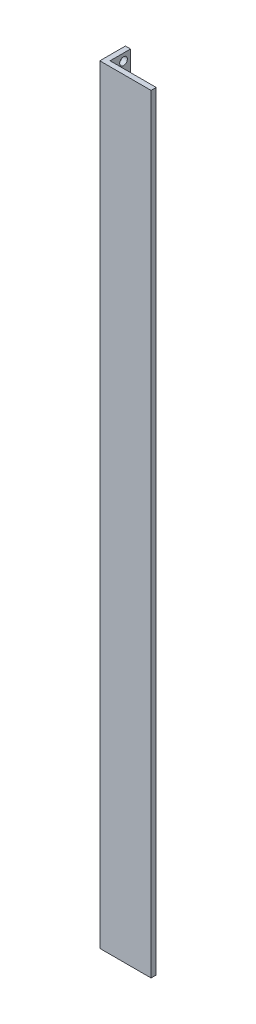
from build123d import *

# Parameters (mm, degrees)
BOSS_EXTRUDE1_DEPTH = 300
SKETCH2_R           = 1.5
CUT_EXTRUDE1_DEPTH  = 301.83217913


with BuildPart() as part:
    # Sketch1 → Boss-Extrude1 (new body)
    with BuildSketch(Plane(origin=(0, 0, 0), x_dir=(1, 0, 0), z_dir=(0, 1, 0))):
        Polygon((0, 0), (0, 10), (2, 10), (2, 2), (20, 2), (20, 0), align=None)
    extrude(amount=BOSS_EXTRUDE1_DEPTH)

    # Sketch2 → Cut-Extrude1 (cut, through all)
    with BuildSketch(Plane.ZY):
        with Locations((-7.262612197, 297.245406858)):
            Circle(SKETCH2_R)
        with Locations((-7.258467028, 88.743438507)):
            Circle(SKETCH2_R)
    extrude(amount=-CUT_EXTRUDE1_DEPTH, mode=Mode.SUBTRACT)


solid = part.part
